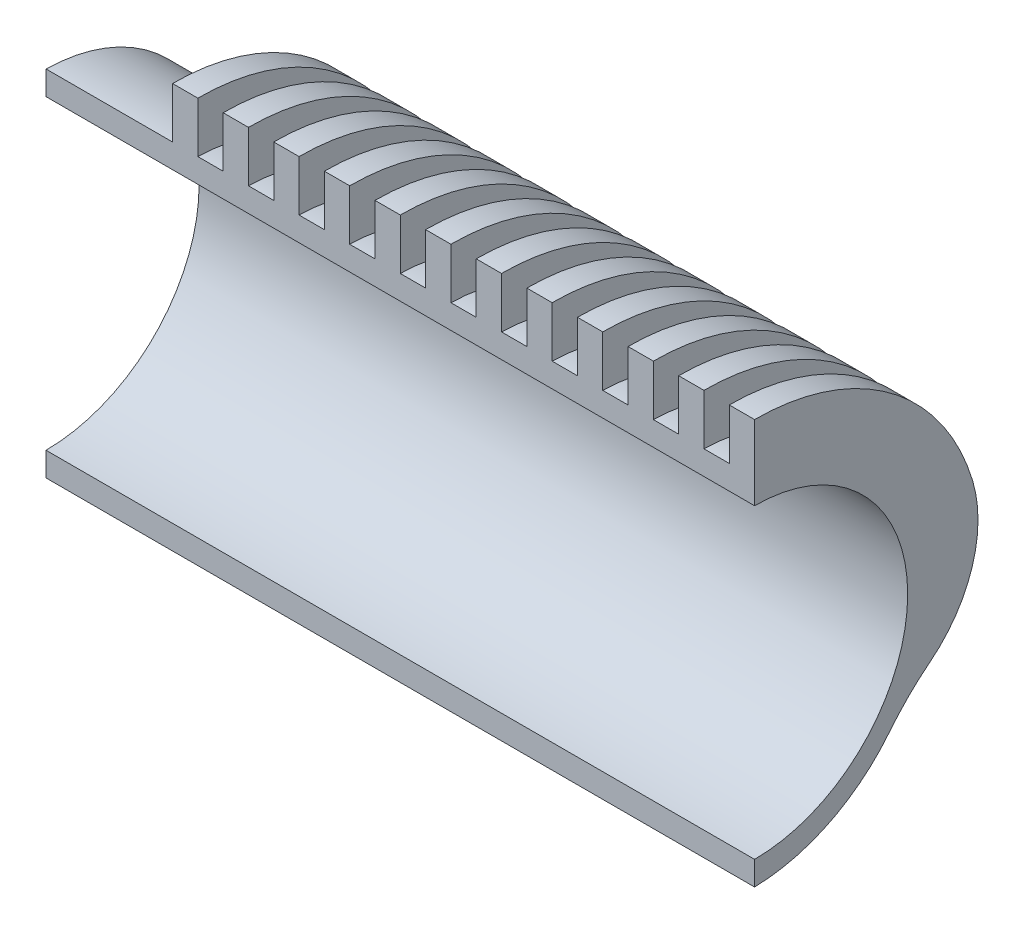
from build123d import *

# Parameters (mm, degrees)
SKETCH1_R           = 7
SKETCH1_R_2         = 0.8
SKETCH1_R_3         = 4
BOSS_EXTRUDE1_DEPTH = 1.5
SKETCH2_R           = 7
SKETCH2_R_2         = 6.4
BOSS_EXTRUDE2_DEPTH = 40.1
BOSS_EXTRUDE5_REACH = 44.786
SKETCH12_R          = 6.4
SKETCH12_R_2        = 6.05
BOSS_EXTRUDE7_START = -1
BOSS_EXTRUDE7_DEPTH = 1
FILLET2_R           = 10
FILLET3_R           = 5
LPATTERN1_START     = 18.6
LPATTERN1_DEPTH     = 1
LPATTERN1_START_2   = 20.6
LPATTERN1_2_DEPTH   = 1
LPATTERN1_START_3   = 22.6
LPATTERN1_3_DEPTH   = 1
LPATTERN1_START_4   = 24.6
LPATTERN1_4_DEPTH   = 1
LPATTERN1_START_5   = 26.6
LPATTERN1_5_DEPTH   = 1
LPATTERN1_START_6   = 28.6
LPATTERN1_6_DEPTH   = 1
LPATTERN1_START_7   = 30.6
LPATTERN1_7_DEPTH   = 1
LPATTERN1_START_8   = 32.6
LPATTERN1_8_DEPTH   = 1
LPATTERN1_START_9   = 34.6
LPATTERN1_9_DEPTH   = 1
LPATTERN1_START_10  = 36.6
LPATTERN1_10_DEPTH  = 1
LPATTERN1_START_11  = 38.6
LPATTERN1_11_DEPTH  = 1
SKETCH15_W          = 17.693531028
SKETCH15_H          = 16
SKETCH16_W          = 28
SKETCH16_H          = 16


with BuildPart() as part:
    # Sketch1 → Boss-Extrude1 (new body)
    with BuildSketch(Plane(origin=(0, 0, 0), x_dir=(0, 0, -1), z_dir=(1, 0, 0))):
        with Locations((-0.15, 0)):
            Circle(SKETCH1_R)
        with Locations((0, 5)):
            Circle(SKETCH1_R_2, mode=Mode.SUBTRACT)
        with Locations((-4.330127019, -2.5)):
            Circle(SKETCH1_R_2, mode=Mode.SUBTRACT)
        with Locations((4.330127019, -2.5)):
            Circle(SKETCH1_R_2, mode=Mode.SUBTRACT)
        Circle(SKETCH1_R_3, mode=Mode.SUBTRACT)
    extrude(amount=BOSS_EXTRUDE1_DEPTH)

    # Sketch2 → Boss-Extrude2 (add)
    with BuildSketch(Plane(origin=(1.5, 0, 0), x_dir=(0, 0, -1), z_dir=(1, 0, 0))):
        with Locations((-0.15, 0)):
            Circle(SKETCH2_R)
        with Locations((-0.15, 0)):
            Circle(SKETCH2_R_2, mode=Mode.SUBTRACT)
    extrude(amount=BOSS_EXTRUDE2_DEPTH)

    # Sketch12 → Boss-Extrude5 (add, up to next)
    with BuildSketch(Plane(origin=(41.6, 0, 0), x_dir=(0, 0, -1), z_dir=(1, 0, 0)), mode=Mode.PRIVATE) as boss_extrude5_sk1:
        with Locations((-0.15, 0)):
            Circle(SKETCH12_R)
        Circle(SKETCH12_R_2, mode=Mode.SUBTRACT)
    boss_extrude5_tool1 = extrude(boss_extrude5_sk1.sketch, amount=-BOSS_EXTRUDE5_REACH, mode=Mode.PRIVATE) - part.part
    add(boss_extrude5_tool1.solids().sort_by_distance((41.6, 0, 6.368981))[0])

    # Sketch14 → Boss-Extrude7 (add)
    with BuildSketch(Plane(origin=(41.6, 0, 0), x_dir=(0, 0, -1), z_dir=(1, 0, 0)).offset(BOSS_EXTRUDE7_START)):
        with BuildLine():
            Line((-7.039083492, -1.241180339), (-8.863269777, -1.562833599))
            ThreePointArc((-8.863269777, -1.562833599), (0, 9), (8.863269777, -1.562833599))
            Line((8.863269777, -1.562833599), (6.748129599, -1.189877318))
            ThreePointArc((6.748129599, -1.189877318), (-0.176047227, 6.999951539), (-7.039083492, -1.241180339))
        make_face()
    extrude(amount=BOSS_EXTRUDE7_DEPTH)

    # Fillet2
    # the kernel refuses this fillet: 10 mm, written as the material it adds along each edge
    with BuildSketch(Plane(origin=(40.6, -1.189877318, -6.748129599), x_dir=(0, -0.9122124275498226, 0.40971756982543417), z_dir=(1, 0, 0))) as fillet2_piece_1:
        with BuildLine():
            CenterArc((5.968676638, 9.685818843), FILLET2_R, 229.495547536, 26.104158306)
            Line((-0.526394739, 2.082263897), (-0.656296166, 1.930192799))
            ThreePointArc((-0.656296166, 1.930192799), (-0.457097485, 0.992114146), (-0.193900116, -0.049017803))
            Line((-0.193900116, -0.049017803), (0.049738972, -0.193716377))
            ThreePointArc((0.049738972, -0.193716377), (1.740864019, 0.01992681), (3.431989067, -0.193716377))
            Line((3.431989067, -0.193716377), (3.481728039, 0))
        make_face()
    extrude(amount=1)
    with BuildSketch(Plane(origin=(40.6, -1.241180339, 7.039083492), x_dir=(0, -0.9145376119425217, -0.4045008731047063), z_dir=(1, 0, 0))) as fillet2_piece_2:
        with BuildLine():
            CenterArc((5.662402917, -9.717692138), FILLET2_R, 103.646653122, 23.987142505)
            Line((-0.443720941, -1.798395993), (-0.565843418, -1.64001007))
            ThreePointArc((-0.565843418, -1.64001007), (-0.416037384, -0.851288435), (-0.194176914, 0.047909561))
            Line((-0.194176914, 0.047909561), (0.047186691, 0.194353843))
            ThreePointArc((0.047186691, 0.194353843), (1.651534184, 0.002384497), (3.255881677, 0.194353843))
            Line((3.255881677, 0.194353843), (3.303068368, 0))
        make_face()
    extrude(amount=1)

    # Fillet3
    fillet3_edges = [part.edges().sort_by_distance(p)[0] for p in [
        (41.1, -1.562833599, 8.863269777),
        (41.1, -1.562833599, -8.863269777),
    ]]
    fillet(fillet3_edges, radius=FILLET3_R)

    # LPattern1: read off the stored shape, not the designer's step
    # LPattern1 outline → LPattern1 (add)
    with BuildSketch(Plane.YZ.offset(LPATTERN1_START)):
        with BuildLine():
            ThreePointArc((-2.762069023, -6.931785952), (-0.336916962, -8.599750686), (2.606424088, -8.614322578))
            ThreePointArc((2.606424088, -8.614322578), (8.998759062, 0.149450112), (2.31893468, 8.696122236))
            ThreePointArc((2.31893468, 8.696122236), (-0.448823677, 8.641049813), (-2.763066821, 7.121905987))
            ThreePointArc((-2.763066821, 7.121905987), (-3.475808056, 6.373673153), (-4.261960597, 5.702989453))
            ThreePointArc((-4.261960597, 5.702989453), (6.999688602, 0.083973644), (-4.365952904, -5.321604449))
            ThreePointArc((-4.365952904, -5.321604449), (-3.518119256, -6.080982981), (-2.762069023, -6.931785952))
        make_face()
    extrude(amount=LPATTERN1_DEPTH)

    # LPattern1 2 outline → LPattern1 2 (add)
    with BuildSketch(Plane.YZ.offset(LPATTERN1_START_2)):
        with BuildLine():
            ThreePointArc((-2.762069023, -6.931785952), (-0.336916962, -8.599750686), (2.606424088, -8.614322578))
            ThreePointArc((2.606424088, -8.614322578), (8.998759062, 0.149450112), (2.31893468, 8.696122236))
            ThreePointArc((2.31893468, 8.696122236), (-0.448823677, 8.641049813), (-2.763066821, 7.121905987))
            ThreePointArc((-2.763066821, 7.121905987), (-3.475808056, 6.373673153), (-4.261960597, 5.702989453))
            ThreePointArc((-4.261960597, 5.702989453), (6.999688602, 0.083973644), (-4.365952904, -5.321604449))
            ThreePointArc((-4.365952904, -5.321604449), (-3.518119256, -6.080982981), (-2.762069023, -6.931785952))
        make_face()
    extrude(amount=LPATTERN1_2_DEPTH)

    # LPattern1 3 outline → LPattern1 3 (add)
    with BuildSketch(Plane.YZ.offset(LPATTERN1_START_3)):
        with BuildLine():
            ThreePointArc((-2.762069023, -6.931785952), (-0.336916962, -8.599750686), (2.606424088, -8.614322578))
            ThreePointArc((2.606424088, -8.614322578), (8.998759062, 0.149450112), (2.31893468, 8.696122236))
            ThreePointArc((2.31893468, 8.696122236), (-0.448823677, 8.641049813), (-2.763066821, 7.121905987))
            ThreePointArc((-2.763066821, 7.121905987), (-3.475808056, 6.373673153), (-4.261960597, 5.702989453))
            ThreePointArc((-4.261960597, 5.702989453), (6.999688602, 0.083973644), (-4.365952904, -5.321604449))
            ThreePointArc((-4.365952904, -5.321604449), (-3.518119256, -6.080982981), (-2.762069023, -6.931785952))
        make_face()
    extrude(amount=LPATTERN1_3_DEPTH)

    # LPattern1 4 outline → LPattern1 4 (add)
    with BuildSketch(Plane.YZ.offset(LPATTERN1_START_4)):
        with BuildLine():
            ThreePointArc((-2.762069023, -6.931785952), (-0.336916962, -8.599750686), (2.606424088, -8.614322578))
            ThreePointArc((2.606424088, -8.614322578), (8.998759062, 0.149450112), (2.31893468, 8.696122236))
            ThreePointArc((2.31893468, 8.696122236), (-0.448823677, 8.641049813), (-2.763066821, 7.121905987))
            ThreePointArc((-2.763066821, 7.121905987), (-3.475808056, 6.373673153), (-4.261960597, 5.702989453))
            ThreePointArc((-4.261960597, 5.702989453), (6.999688602, 0.083973644), (-4.365952904, -5.321604449))
            ThreePointArc((-4.365952904, -5.321604449), (-3.518119256, -6.080982981), (-2.762069023, -6.931785952))
        make_face()
    extrude(amount=LPATTERN1_4_DEPTH)

    # LPattern1 5 outline → LPattern1 5 (add)
    with BuildSketch(Plane.YZ.offset(LPATTERN1_START_5)):
        with BuildLine():
            ThreePointArc((-2.762069023, -6.931785952), (-0.336916962, -8.599750686), (2.606424088, -8.614322578))
            ThreePointArc((2.606424088, -8.614322578), (8.998759062, 0.149450112), (2.31893468, 8.696122236))
            ThreePointArc((2.31893468, 8.696122236), (-0.448823677, 8.641049813), (-2.763066821, 7.121905987))
            ThreePointArc((-2.763066821, 7.121905987), (-3.475808056, 6.373673153), (-4.261960597, 5.702989453))
            ThreePointArc((-4.261960597, 5.702989453), (6.999688602, 0.083973644), (-4.365952904, -5.321604449))
            ThreePointArc((-4.365952904, -5.321604449), (-3.518119256, -6.080982981), (-2.762069023, -6.931785952))
        make_face()
    extrude(amount=LPATTERN1_5_DEPTH)

    # LPattern1 6 outline → LPattern1 6 (add)
    with BuildSketch(Plane.YZ.offset(LPATTERN1_START_6)):
        with BuildLine():
            ThreePointArc((-2.762069023, -6.931785952), (-0.336916962, -8.599750686), (2.606424088, -8.614322578))
            ThreePointArc((2.606424088, -8.614322578), (8.998759062, 0.149450112), (2.31893468, 8.696122236))
            ThreePointArc((2.31893468, 8.696122236), (-0.448823677, 8.641049813), (-2.763066821, 7.121905987))
            ThreePointArc((-2.763066821, 7.121905987), (-3.475808056, 6.373673153), (-4.261960597, 5.702989453))
            ThreePointArc((-4.261960597, 5.702989453), (6.999688602, 0.083973644), (-4.365952904, -5.321604449))
            ThreePointArc((-4.365952904, -5.321604449), (-3.518119256, -6.080982981), (-2.762069023, -6.931785952))
        make_face()
    extrude(amount=LPATTERN1_6_DEPTH)

    # LPattern1 7 outline → LPattern1 7 (add)
    with BuildSketch(Plane.YZ.offset(LPATTERN1_START_7)):
        with BuildLine():
            ThreePointArc((-2.762069023, -6.931785952), (-0.336916962, -8.599750686), (2.606424088, -8.614322578))
            ThreePointArc((2.606424088, -8.614322578), (8.998759062, 0.149450112), (2.31893468, 8.696122236))
            ThreePointArc((2.31893468, 8.696122236), (-0.448823677, 8.641049813), (-2.763066821, 7.121905987))
            ThreePointArc((-2.763066821, 7.121905987), (-3.475808056, 6.373673153), (-4.261960597, 5.702989453))
            ThreePointArc((-4.261960597, 5.702989453), (6.999688602, 0.083973644), (-4.365952904, -5.321604449))
            ThreePointArc((-4.365952904, -5.321604449), (-3.518119256, -6.080982981), (-2.762069023, -6.931785952))
        make_face()
    extrude(amount=LPATTERN1_7_DEPTH)

    # LPattern1 8 outline → LPattern1 8 (add)
    with BuildSketch(Plane.YZ.offset(LPATTERN1_START_8)):
        with BuildLine():
            ThreePointArc((-2.762069023, -6.931785952), (-0.336916962, -8.599750686), (2.606424088, -8.614322578))
            ThreePointArc((2.606424088, -8.614322578), (8.998759062, 0.149450112), (2.31893468, 8.696122236))
            ThreePointArc((2.31893468, 8.696122236), (-0.448823677, 8.641049813), (-2.763066821, 7.121905987))
            ThreePointArc((-2.763066821, 7.121905987), (-3.475808056, 6.373673153), (-4.261960597, 5.702989453))
            ThreePointArc((-4.261960597, 5.702989453), (6.999688602, 0.083973644), (-4.365952904, -5.321604449))
            ThreePointArc((-4.365952904, -5.321604449), (-3.518119256, -6.080982981), (-2.762069023, -6.931785952))
        make_face()
    extrude(amount=LPATTERN1_8_DEPTH)

    # LPattern1 9 outline → LPattern1 9 (add)
    with BuildSketch(Plane.YZ.offset(LPATTERN1_START_9)):
        with BuildLine():
            ThreePointArc((-2.762069023, -6.931785952), (-0.336916962, -8.599750686), (2.606424088, -8.614322578))
            ThreePointArc((2.606424088, -8.614322578), (8.998759062, 0.149450112), (2.31893468, 8.696122236))
            ThreePointArc((2.31893468, 8.696122236), (-0.448823677, 8.641049813), (-2.763066821, 7.121905987))
            ThreePointArc((-2.763066821, 7.121905987), (-3.475808056, 6.373673153), (-4.261960597, 5.702989453))
            ThreePointArc((-4.261960597, 5.702989453), (6.999688602, 0.083973644), (-4.365952904, -5.321604449))
            ThreePointArc((-4.365952904, -5.321604449), (-3.518119256, -6.080982981), (-2.762069023, -6.931785952))
        make_face()
    extrude(amount=LPATTERN1_9_DEPTH)

    # LPattern1 10 outline → LPattern1 10 (add)
    with BuildSketch(Plane.YZ.offset(LPATTERN1_START_10)):
        with BuildLine():
            ThreePointArc((-2.762069023, -6.931785952), (-0.336916962, -8.599750686), (2.606424088, -8.614322578))
            ThreePointArc((2.606424088, -8.614322578), (8.998759062, 0.149450112), (2.31893468, 8.696122236))
            ThreePointArc((2.31893468, 8.696122236), (-0.448823677, 8.641049813), (-2.763066821, 7.121905987))
            ThreePointArc((-2.763066821, 7.121905987), (-3.475808056, 6.373673153), (-4.261960597, 5.702989453))
            ThreePointArc((-4.261960597, 5.702989453), (6.999688602, 0.083973644), (-4.365952904, -5.321604449))
            ThreePointArc((-4.365952904, -5.321604449), (-3.518119256, -6.080982981), (-2.762069023, -6.931785952))
        make_face()
    extrude(amount=LPATTERN1_10_DEPTH)

    # LPattern1 11 outline → LPattern1 11 (add)
    with BuildSketch(Plane.YZ.offset(LPATTERN1_START_11)):
        with BuildLine():
            ThreePointArc((-2.762069023, -6.931785952), (-0.336916962, -8.599750686), (2.606424088, -8.614322578))
            ThreePointArc((2.606424088, -8.614322578), (8.998759062, 0.149450112), (2.31893468, 8.696122236))
            ThreePointArc((2.31893468, 8.696122236), (-0.448823677, 8.641049813), (-2.763066821, 7.121905987))
            ThreePointArc((-2.763066821, 7.121905987), (-3.475808056, 6.373673153), (-4.261960597, 5.702989453))
            ThreePointArc((-4.261960597, 5.702989453), (6.999688602, 0.083973644), (-4.365952904, -5.321604449))
            ThreePointArc((-4.365952904, -5.321604449), (-3.518119256, -6.080982981), (-2.762069023, -6.931785952))
        make_face()
    extrude(amount=LPATTERN1_11_DEPTH)


with BuildPart() as body_2:
    # Split2: the piece behind the surface
    add(part.part)
    # Sketch15 → Surface-Plane1: a flat surface bounded by the sketch
    with BuildSketch(Plane.ZY.offset(-13.6), mode=Mode.PRIVATE) as surface_plane1_1_region:
        with Locations((0.018177702, 1)):
            Rectangle(SKETCH15_W, SKETCH15_H)
    surface_plane1_1 = surface_plane1_1_region.sketch.faces()[0]
    split(bisect_by=surface_plane1_1, keep=Keep.BOTTOM)


with BuildPart() as part_1:
    add(part.part)

    # Split2: split by a surface, the side it looks to stays
    # Sketch15 → Surface-Plane1: a flat surface bounded by the sketch
    with BuildSketch(Plane.ZY.offset(-13.6), mode=Mode.PRIVATE) as surface_plane1_2_region:
        with Locations((0.018177702, 1)):
            Rectangle(SKETCH15_W, SKETCH15_H)
    surface_plane1_2 = surface_plane1_2_region.sketch.faces()[0]
    split(bisect_by=surface_plane1_2, keep=Keep.TOP)


with BuildPart() as body_2_2:
    # Split3: the piece behind the surface
    add(body_2.part)
    # Sketch16 → Surface-Plane2: a flat surface bounded by the sketch
    with BuildSketch(Plane.XY, mode=Mode.PRIVATE) as surface_plane2_3_region:
        with Locations((27.6, 1)):
            Rectangle(SKETCH16_W, SKETCH16_H)
    surface_plane2_3 = surface_plane2_3_region.sketch.faces()[0]
    split(bisect_by=surface_plane2_3, keep=Keep.BOTTOM)


with BuildPart() as body_2_1:
    add(body_2.part)

    # Split3: split by a surface, the side it looks to stays
    # Sketch16 → Surface-Plane2: a flat surface bounded by the sketch
    with BuildSketch(Plane.XY, mode=Mode.PRIVATE) as surface_plane2_4_region:
        with Locations((27.6, 1)):
            Rectangle(SKETCH16_W, SKETCH16_H)
    surface_plane2_4 = surface_plane2_4_region.sketch.faces()[0]
    split(bisect_by=surface_plane2_4, keep=Keep.TOP)


solid = body_2_2.part
